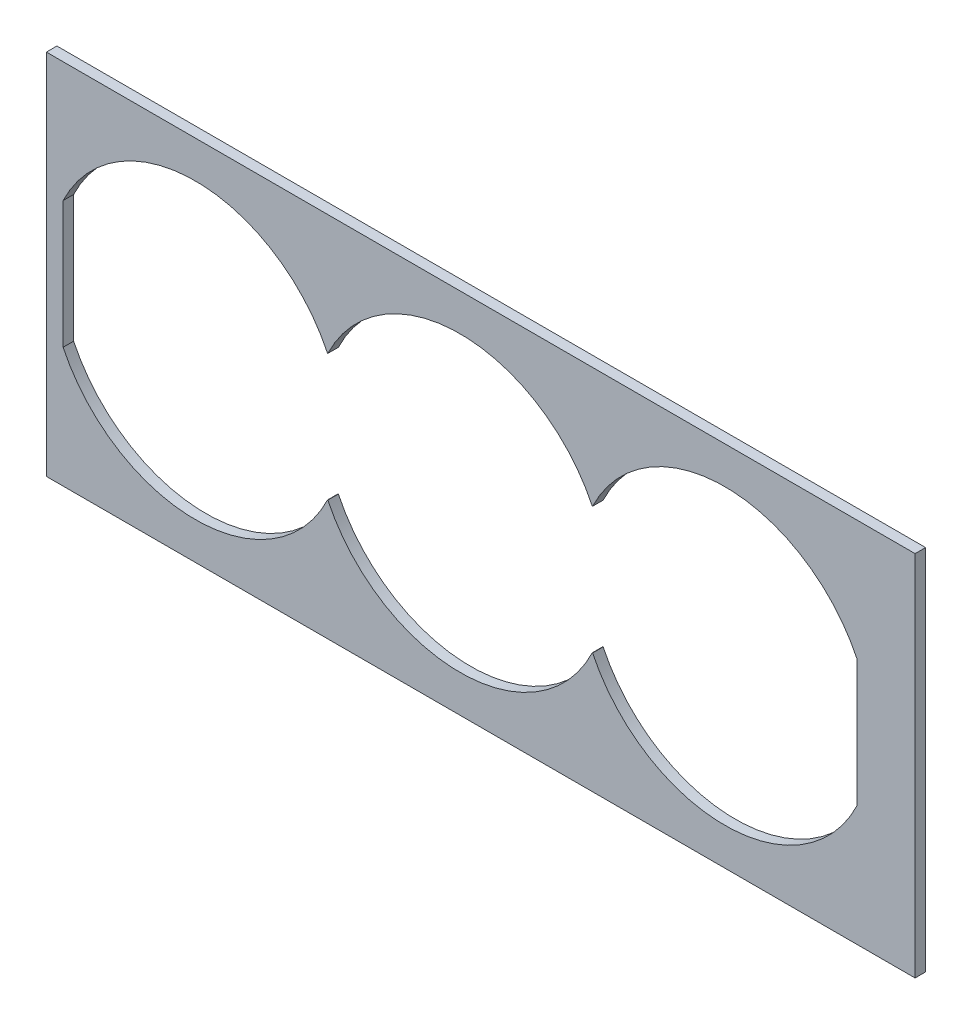
from build123d import *

# Parameters (mm, degrees)
SKETCH4_W                                = 330.2
SKETCH4_H                                = 139.7
DIMENSIONS_CONTROL_OPTICS_LOCATION_DEPTH = 4


with BuildPart() as part:
    # Sketch4 → DIMENSIONS CONTROL OPTICS LOCATION (new body)
    with BuildSketch(Plane.XY):
        with Locations((165.1, 69.85)):
            Rectangle(SKETCH4_W, SKETCH4_H)
        with BuildLine():
            Line((6.35, 93.996304065), (6.35, 45.703695935))
            ThreePointArc((6.35, 45.703695935), (56.604, 14.096), (106.858, 45.703695935))
            Line((106.858, 45.703695935), (106.985, 45.703695935))
            ThreePointArc((106.985, 45.703695935), (157.239, 14.096), (207.493, 45.703695935))
            Line((207.493, 45.703695935), (207.62, 45.703695935))
            ThreePointArc((207.62, 45.703695935), (257.874, 14.096), (308.128, 45.703695935))
            Line((308.128, 45.703695935), (308.128, 93.996304065))
            ThreePointArc((308.128, 93.996304065), (257.874, 125.604), (207.62, 93.996304065))
            Line((207.62, 93.996304065), (207.493, 93.996304065))
            ThreePointArc((207.493, 93.996304065), (157.239, 125.604), (106.985, 93.996304065))
            Line((106.985, 93.996304065), (106.858, 93.996304065))
            ThreePointArc((106.858, 93.996304065), (56.604, 125.604), (6.35, 93.996304065))
        make_face(mode=Mode.SUBTRACT)
    extrude(amount=DIMENSIONS_CONTROL_OPTICS_LOCATION_DEPTH)


solid = part.part
